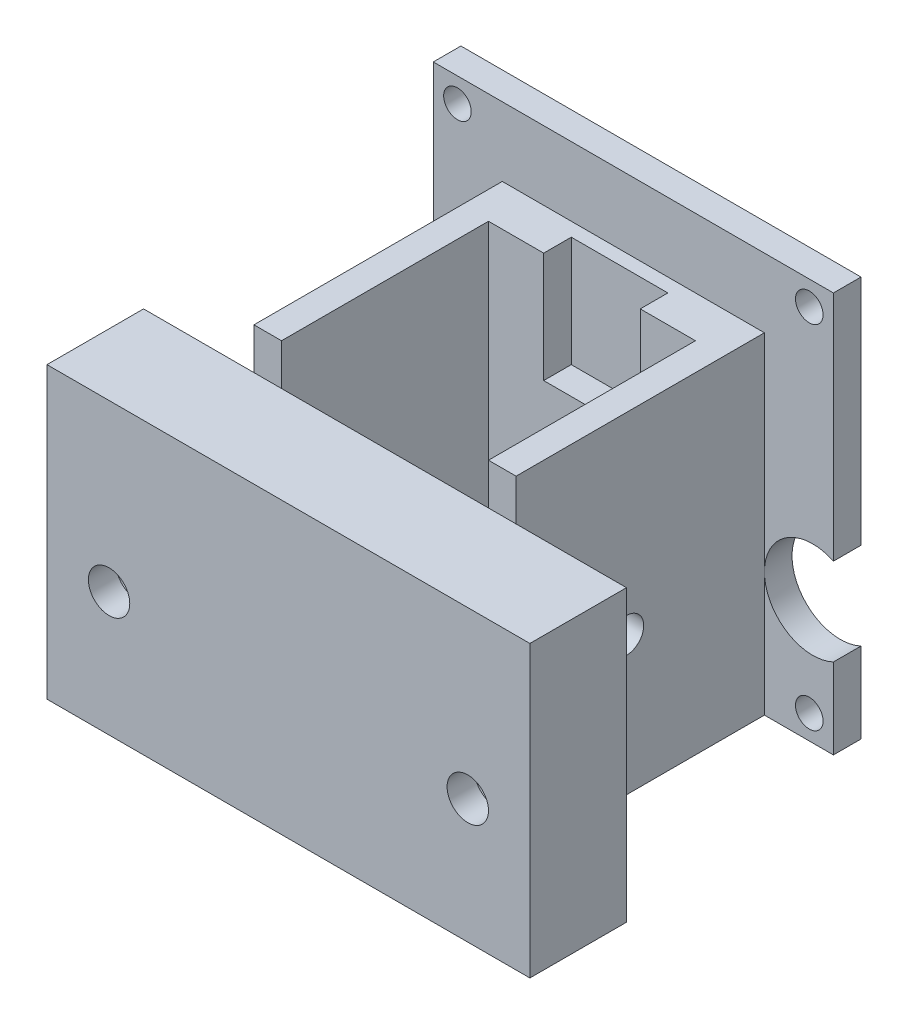
from build123d import *

# Parameters (mm, degrees)
AUFSATZ_LINEAR_AUSTRAGEN1_OUTLINE_W = 29
AUFSATZ_LINEAR_AUSTRAGEN1_OUTLINE_H = 29
AUFSATZ_LINEAR_AUSTRAGEN1_DEPTH     = 2
SKIZZE2_W                           = 19
SKIZZE2_H                           = 24
AUFSATZ_LINEAR_AUSTRAGEN2_DEPTH     = 18
SKIZZE5_W                           = 15
SKIZZE5_H                           = 24
SCHNITT_LINEAR_AUSTRAGEN2_DEPTH     = 15
SCHNITT_LINEAR_AUSTRAGEN3_REACH     = 44.626
SKIZZE4_R                           = 1.25
SKIZZE6_W                           = 35
SKIZZE6_H                           = 24
AUFSATZ_LINEAR_AUSTRAGEN3_DEPTH     = 7
SKIZZE9_R                           = 2
SCHNITT_LINEAR_AUSTRAGEN4_DEPTH     = 5
SKIZZE19_W                          = 17
SKIZZE19_H                          = 5
SCHNITT_LINEAR_AUSTRAGEN15_DEPTH    = 2
SKIZZE20_R                          = 1.5
SCHNITT_LINEAR_AUSTRAGEN16_DEPTH    = 2
SKIZZE21_W                          = 7
SKIZZE21_H                          = 8
SCHNITT_LINEAR_AUSTRAGEN17_DEPTH    = 2
SKIZZE23_W                          = 6.5
SKIZZE23_H                          = 5
SKIZZE23_W_2                        = 5.5
SCHNITT_LINEAR_AUSTRAGEN18_DEPTH    = 2
SKIZZE24_W                          = 29
SKIZZE24_H                          = 2
AUFSATZ_LINEAR_AUSTRAGEN4_DEPTH     = 5
SKIZZE25_R                          = 1
SCHNITT_LINEAR_AUSTRAGEN19_DEPTH    = 2
SKIZZE26_W                          = 35
SKIZZE26_H                          = 3
SCHNITT_LINEAR_AUSTRAGEN20_DEPTH    = 7
SKIZZE27_R                          = 3.5
SCHNITT_LINEAR_AUSTRAGEN21_DEPTH    = 2


# Read off the part's stored shape, not the designer's step: Aufsatz-Linear austragen1
with BuildPart() as part:
    # Aufsatz-Linear austragen1 outline → Aufsatz-Linear austragen1 (new body)
    with BuildSketch(Plane.XY):
        with Locations((14.5, 14.5)):
            Rectangle(AUFSATZ_LINEAR_AUSTRAGEN1_OUTLINE_W, AUFSATZ_LINEAR_AUSTRAGEN1_OUTLINE_H)
    extrude(amount=AUFSATZ_LINEAR_AUSTRAGEN1_DEPTH)

    # Skizze2 → Aufsatz-Linear austragen2 (add)
    with BuildSketch(Plane.XY.offset(2)):
        with Locations((14.5, 17)):
            Rectangle(SKIZZE2_W, SKIZZE2_H)
    extrude(amount=AUFSATZ_LINEAR_AUSTRAGEN2_DEPTH)

    # Skizze5 → Schnitt-Linear austragen2 (cut)
    with BuildSketch(Plane.XY.offset(20)):
        with Locations((14.5, 17)):
            Rectangle(SKIZZE5_W, SKIZZE5_H)
    extrude(amount=-SCHNITT_LINEAR_AUSTRAGEN2_DEPTH, mode=Mode.SUBTRACT)

    # Schnitt-Linear austragen3: up to this face of the body (flat: up to its plane)
    schnitt_linear_austragen3_end = Plane(part.part.faces().sort_by_distance((24, 17, 11))[0])
    # Skizze4 → Schnitt-Linear austragen3 (cut, up to the picked face)
    with BuildSketch(Plane.ZY.offset(-5), mode=Mode.PRIVATE) as schnitt_linear_austragen3_sk1:
        with Locations((12, 15)):
            Circle(SKIZZE4_R)
    schnitt_linear_austragen3_tool1 = split(extrude(schnitt_linear_austragen3_sk1.sketch, amount=-SCHNITT_LINEAR_AUSTRAGEN3_REACH, mode=Mode.PRIVATE), bisect_by=schnitt_linear_austragen3_end, keep=Keep.BOTH, mode=Mode.PRIVATE)
    add(schnitt_linear_austragen3_tool1.solids().sort_by(Axis((5, 15, 12), (1, 0, 0)))[0], mode=Mode.SUBTRACT)

    # Skizze6 → Aufsatz-Linear austragen3 (add)
    with BuildSketch(Plane.XY.offset(20)):
        with Locations((14.5, 17)):
            Rectangle(SKIZZE6_W, SKIZZE6_H)
    extrude(amount=AUFSATZ_LINEAR_AUSTRAGEN3_DEPTH)

    # Skizze9 → Schnitt-Linear austragen4 (cut)
    with BuildSketch(Plane(origin=(0, 0, 20), x_dir=(-1, 0, 0), z_dir=(0, 0, -1))):
        with Locations((-1.5, 14)):
            Circle(SKIZZE9_R)
        with Locations((-27.5, 14)):
            Circle(SKIZZE9_R)
    extrude(amount=-SCHNITT_LINEAR_AUSTRAGEN4_DEPTH, mode=Mode.SUBTRACT)

    # Skizze19 → Schnitt-Linear austragen15 (cut)
    with BuildSketch(Plane(origin=(0, 0, 0), x_dir=(-1, 0, 0), z_dir=(0, 0, -1))):
        with Locations((-14, 2.5)):
            Rectangle(SKIZZE19_W, SKIZZE19_H)
    extrude(amount=-SCHNITT_LINEAR_AUSTRAGEN15_DEPTH, mode=Mode.SUBTRACT)

    # Skizze20 → Schnitt-Linear austragen16 (cut)
    with BuildSketch(Plane(origin=(0, 0, 25), x_dir=(-1, 0, 0), z_dir=(0, 0, -1))):
        with Locations((-27.5, 14)):
            Circle(SKIZZE20_R)
        with Locations((-1.5, 14)):
            Circle(SKIZZE20_R)
    extrude(amount=-SCHNITT_LINEAR_AUSTRAGEN16_DEPTH, mode=Mode.SUBTRACT)

    # Skizze21 → Schnitt-Linear austragen17 (cut)
    with BuildSketch(Plane.XY.offset(5)):
        with Locations((14.5, 25)):
            Rectangle(SKIZZE21_W, SKIZZE21_H)
    extrude(amount=-SCHNITT_LINEAR_AUSTRAGEN17_DEPTH, mode=Mode.SUBTRACT)

    # Skizze23 → Schnitt-Linear austragen18 (cut)
    with BuildSketch(Plane(origin=(0, 0, 0), x_dir=(-1, 0, 0), z_dir=(0, 0, -1))):
        with Locations((-25.75, 2.5)):
            Rectangle(SKIZZE23_W, SKIZZE23_H)
        with Locations((-2.75, 2.5)):
            Rectangle(SKIZZE23_W_2, SKIZZE23_H)
    extrude(amount=-SCHNITT_LINEAR_AUSTRAGEN18_DEPTH, mode=Mode.SUBTRACT)

    # Skizze24 → Aufsatz-Linear austragen4 (add)
    with BuildSketch(Plane(origin=(0, 29, 0), x_dir=(1, 0, 0), z_dir=(0, 1, 0))):
        with Locations((14.5, -1)):
            Rectangle(SKIZZE24_W, SKIZZE24_H)
    extrude(amount=AUFSATZ_LINEAR_AUSTRAGEN4_DEPTH)

    # Skizze25 → Schnitt-Linear austragen19 (cut)
    with BuildSketch(Plane(origin=(0, 0, 0), x_dir=(-1, 0, 0), z_dir=(0, 0, -1))):
        with Locations((-1.75, 32.25)):
            Circle(SKIZZE25_R)
        with Locations((-27.25, 32.25)):
            Circle(SKIZZE25_R)
        with Locations((-27.25, 6.75)):
            Circle(SKIZZE25_R)
        with Locations((-1.75, 6.75)):
            Circle(SKIZZE25_R)
    extrude(amount=-SCHNITT_LINEAR_AUSTRAGEN19_DEPTH, mode=Mode.SUBTRACT)

    # Skizze26 → Schnitt-Linear austragen20 (cut)
    with BuildSketch(Plane.XY.offset(27)):
        with Locations((14.5, 27.5)):
            Rectangle(SKIZZE26_W, SKIZZE26_H)
    extrude(amount=-SCHNITT_LINEAR_AUSTRAGEN20_DEPTH, mode=Mode.SUBTRACT)

    # Skizze27 → Schnitt-Linear austragen21 (cut)
    with BuildSketch(Plane(origin=(0, 0, 0), x_dir=(-1, 0, 0), z_dir=(0, 0, -1))):
        with Locations((-27.5, 14)):
            Circle(SKIZZE27_R)
        with Locations((-1.5, 14)):
            Circle(SKIZZE27_R)
    extrude(amount=-SCHNITT_LINEAR_AUSTRAGEN21_DEPTH, mode=Mode.SUBTRACT)


solid = part.part
